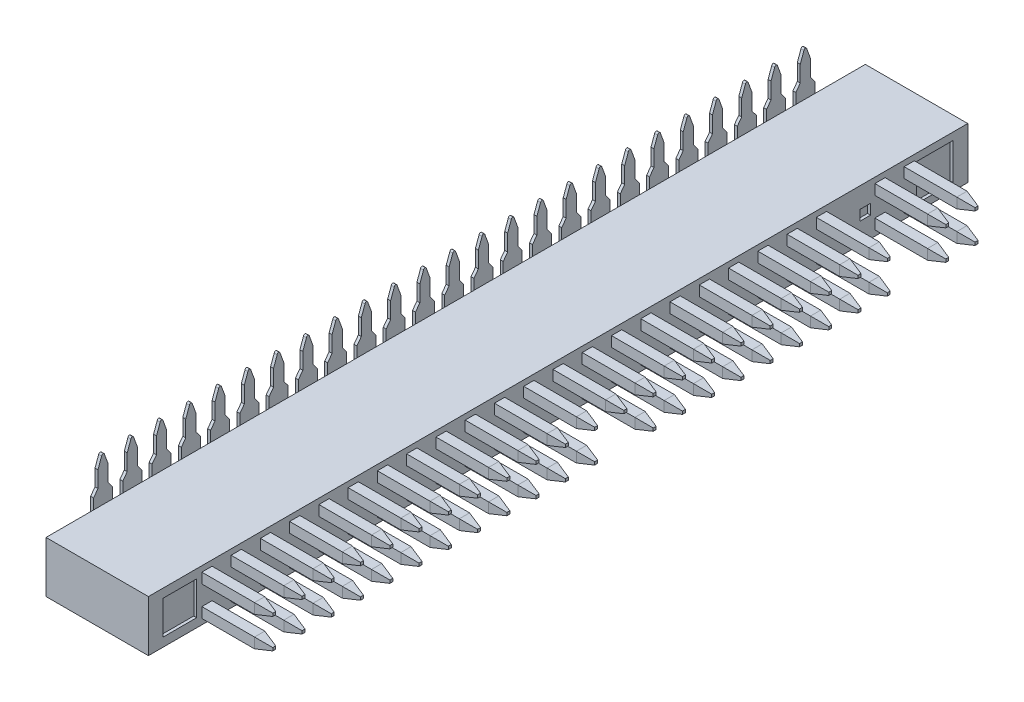
from build123d import *

# Parameters (mm, degrees)
CROQUIS1_W           = 56
CROQUIS1_H           = 3.5
EXTRUIR1_DEPTH       = 3.5
CROQUIS2_W           = 0.7
CROQUIS2_H           = 0.7
EXTRUIR2_DEPTH       = 3.6
MATRIZL1_COUNT       = 25
MATRIZL1_PITCH       = 2
MATRIZL1_COUNT_DIR2  = 2
MATRIZL1_PITCH_DIR2  = 2.04
CROQUIS7_W           = 0.7
CROQUIS7_H           = 0.7
EXTRUIR3_DEPTH       = 0.2
MATRIZL2_COUNT       = 23
MATRIZL2_PITCH       = 2
CROQUIS8_W           = 2.3
CROQUIS8_H           = 2.3
CROQUIS8_W_2         = 2.5
CROQUIS8_H_2         = 2.5
EXTRUIR4_DEPTH       = 0.2
CROQUIS9_W           = 7
CROQUIS9_H           = 0.7
EXTRUIR5_DEPTH       = 0.2
MATRIZL3_COUNT       = 21
MATRIZL3_PITCH       = 2
EXTRUIR6_DEPTH       = 0.5
EXTRUIR7_START       = -0.7
CROQUIS11_W          = 7.1
CROQUIS11_H          = 0.7
EXTRUIR7_DEPTH       = 0.7
EXTRUIR8_DEPTH       = 0.2
MATRIZL4_START       = -1.37
MATRIZL4_OUTLINE_W   = 0.1
MATRIZL4_OUTLINE_H   = 47.3
MATRIZL4_DEPTH       = 0.7
MATRIZL4_START_2     = 0.67
MATRIZL4_2_OUTLINE_W = 0.1
MATRIZL4_2_OUTLINE_H = 47.3
MATRIZL4_2_DEPTH     = 0.7
MATRIZL5_COUNT       = 25
MATRIZL5_PITCH       = 2


with BuildPart() as part:
    # Croquis1 → Extruir1 (new, symmetric)
    with BuildSketch(Plane(origin=(0, 0, 0), x_dir=(0, 0, -1), z_dir=(1, 0, 0))):
        Rectangle(CROQUIS1_W, CROQUIS1_H)
    extrude(amount=EXTRUIR1_DEPTH, both=True)

    # Croquis2 → Extruir2 (add)
    with BuildSketch(Plane(origin=(3.5, 0, 0), x_dir=(0, 0, -1), z_dir=(1, 0, 0))):
        with Locations((-24, 1.02)):
            Rectangle(CROQUIS2_W, CROQUIS2_H)
    extruir2 = extrude(amount=EXTRUIR2_DEPTH)

    # Croquis5 → Recubrir1 section 0
    with BuildSketch(Plane(origin=(8.1, 0, 0), x_dir=(0, 0, -1), z_dir=(1, 0, 0))):
        with BuildLine():
            Line((-23.9, 0.92), (-23.9, 1.12))
            Line((-23.9, 1.12), (-24.1, 1.12))
            Line((-24.1, 1.12), (-24.1, 0.92))
            Line((-24.1, 0.92), (-23.9, 0.92))
        make_face()
    # Croquis6 → Recubrir1 section 1
    with BuildSketch(Plane(origin=(7.1, 0, 0), x_dir=(0, 0, -1), z_dir=(1, 0, 0))):
        with BuildLine():
            Line((-23.65, 0.67), (-23.65, 1.37))
            Line((-23.65, 1.37), (-24.35, 1.37))
            Line((-24.35, 1.37), (-24.35, 0.67))
            Line((-24.35, 0.67), (-23.65, 0.67))
        make_face()
    recubrir1 = loft()

    # MatrizL1: Extruir2, Recubrir1 25 × 2, 3 skipped
    with Locations(*[(0, -j * MATRIZL1_PITCH_DIR2, -i * MATRIZL1_PITCH) for i in range(MATRIZL1_COUNT) for j in range(MATRIZL1_COUNT_DIR2) if (i, j) not in ((0, 0), (12, 1), (22, 0), (22, 1))]):
        add(extruir2)
        add(recubrir1)

    # Croquis7 → Extruir3 (cut)
    with BuildSketch(Plane(origin=(3.5, 0, 0), x_dir=(0, 0, -1), z_dir=(1, 0, 0))):
        with Locations((-23, 0)):
            Rectangle(CROQUIS7_W, CROQUIS7_H)
    extruir3 = extrude(amount=-EXTRUIR3_DEPTH, mode=Mode.SUBTRACT)

    # MatrizL2: Extruir3 ×23
    with Locations(*[(0, 0, -i * MATRIZL2_PITCH) for i in range(1, MATRIZL2_COUNT)]):
        add(extruir3, mode=Mode.SUBTRACT)

    # Croquis8 → Extruir4 (cut)
    with BuildSketch(Plane(origin=(3.5, 0, 0), x_dir=(0, 0, -1), z_dir=(1, 0, 0))):
        with Locations((-25.85, 0)):
            Rectangle(CROQUIS8_W, CROQUIS8_H)
        with Locations((25.75, 0)):
            Rectangle(CROQUIS8_W_2, CROQUIS8_H_2)
    extrude(amount=-EXTRUIR4_DEPTH, mode=Mode.SUBTRACT)

    # Croquis9 → Extruir5 (cut)
    with BuildSketch(Plane.XZ.offset(1.75)):
        with Locations((0, 19.3)):
            Rectangle(CROQUIS9_W, CROQUIS9_H)
    extruir5 = extrude(amount=-EXTRUIR5_DEPTH, mode=Mode.SUBTRACT)

    # MatrizL3: Extruir5 ×21, 2 skipped
    with Locations(*[(0, 0, -i * MATRIZL3_PITCH) for i in range(1, MATRIZL3_COUNT) if i not in (9, 10)]):
        add(extruir5, mode=Mode.SUBTRACT)

    # Croquis10 → Extruir6 (add, symmetric)
    with BuildSketch(Plane.XY):
        Polygon((3.4, -1.75), (2.5, -2.05), (1.5, -2.05), (1.5, -1.75), align=None)
    extrude(amount=EXTRUIR6_DEPTH, both=True)

    # Croquis11 → Extruir7 (add)
    with BuildSketch(Plane.XY.offset(24.35).offset(EXTRUIR7_START)):
        with Locations((-0.05, 1.02)):
            Rectangle(CROQUIS11_W, CROQUIS11_H)
        with Locations((-0.05, -1.02)):
            Rectangle(CROQUIS11_W, CROQUIS11_H)
    extrude(amount=EXTRUIR7_DEPTH)

    # Croquis12 → Extruir8 (add)
    with BuildSketch(Plane.ZY.offset(3.6)):
        with BuildLine():
            Line((23.35, 2.360264451), (23.65, 2.766220007))
            Line((23.65, 2.766220007), (23.65, 3.880847884))
            Line((23.65, 3.880847884), (23.90045468, 4.56697726))
            ThreePointArc((23.90045468, 4.56697726), (24, 4.657452069), (24.09954532, 4.56697726))
            Line((24.09954532, 4.56697726), (24.349090834, 3.880847884))
            Line((24.349090834, 3.880847884), (24.349090834, 2.766220007))
            Line((24.349090834, 2.766220007), (24.65, 2.360264451))
            Line((24.65, 2.360264451), (24.65, -1.67))
            Line((24.65, -1.67), (23.35, -1.67))
            Line((23.35, -1.67), (23.35, 2.360264451))
        make_face()
    extruir8 = extrude(amount=EXTRUIR8_DEPTH)

    # MatrizL4: read off the stored shape, not the designer's step
    # MatrizL4 outline → MatrizL4 (add)
    with BuildSketch(Plane(origin=(0, 0, 0), x_dir=(1, 0, 0), z_dir=(0, 1, 0)).offset(MATRIZL4_START)):
        with Locations((-3.55, 0)):
            Rectangle(MATRIZL4_OUTLINE_W, MATRIZL4_OUTLINE_H)
    extrude(amount=MATRIZL4_DEPTH)

    # MatrizL4 2 outline → MatrizL4 2 (add)
    with BuildSketch(Plane(origin=(0, 0, 0), x_dir=(1, 0, 0), z_dir=(0, 1, 0)).offset(MATRIZL4_START_2)):
        with Locations((-3.55, 0)):
            Rectangle(MATRIZL4_2_OUTLINE_W, MATRIZL4_2_OUTLINE_H)
    extrude(amount=MATRIZL4_2_DEPTH)

    # MatrizL5: Extruir8 ×25
    with Locations(*[(0, 0, -i * MATRIZL5_PITCH) for i in range(1, MATRIZL5_COUNT)]):
        add(extruir8)


solid = part.part
